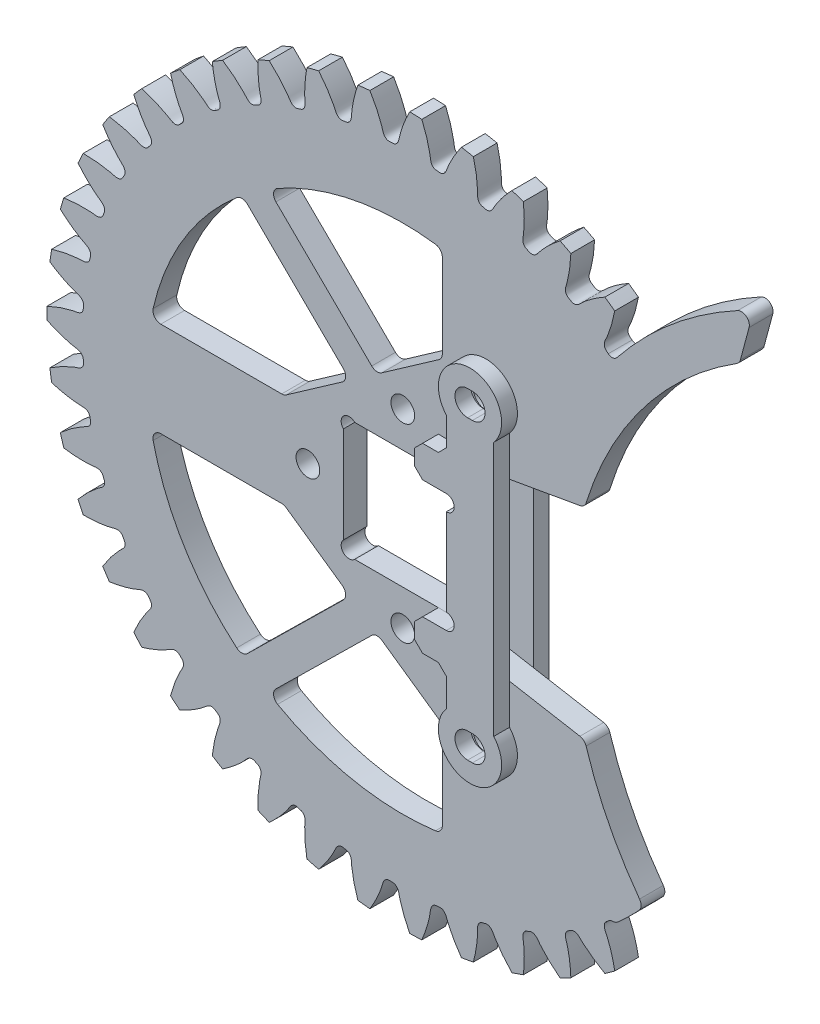
from build123d import *

# Parameters (mm, degrees)
SKETCH_432_W               = 3
SKETCH_432_H               = 44.999999324
CUT_EXTRUDE_650_DEPTH      = 2
PATTERN_CIRCULAR_704_COUNT = 43
SKETCH_763_W               = 4
SKETCH_763_H               = 5
SKETCH_1_R                 = 1
SKETCH_1_W                 = 15
SKETCH_1_H                 = 15
CUT_EXTRUDE_1_DEPTH        = 64.704229892
SKETCH_2_R                 = 1.5
CUT_EXTRUDE_2_DEPTH        = 64.704229892
SKETCH_3_R                 = 50
CUT_EXTRUDE_3_DEPTH        = 64.704229892
EXTRUDE_1_DEPTH            = 3
FILLET_1_R                 = 1
FILLET_START               = -1.5
FILLET_4_DEPTH             = 3
CUT_EXTRUDE_4_DEPTH        = 64.704229892
FILLET_2_R                 = 1
SKETCH_6_R                 = 1.6
CUT_EXTRUDE_5_DEPTH        = 64.704229892
FILLET_3_R                 = 1
CHAMFER_1_SIZE             = 1
EXTRUDE_2_DEPTH            = 2
CHAMFER_2_SIZE             = 1


with BuildPart() as part:
    # Sketch 432 → Revolve 518 (revolve)
    with BuildSketch(Plane(origin=(0, 0, 0), x_dir=(0, 0, -1), z_dir=(1, 0, 0)), mode=Mode.PRIVATE) as revolve_518_sk:
        with Locations((0, 22.499999662)):
            Rectangle(SKETCH_432_W, SKETCH_432_H)
    revolve(revolve_518_sk.sketch.rotate(Axis((0, 0, 0), (0, 0, -1)), 90), axis=Axis((0, 0, 0), (0, 0, -1)))

    # Sketch 563 → Cut-Extrude 650 (cut, symmetric)
    with BuildSketch(Plane.XY):
        with BuildLine():
            ThreePointArc((45.026398895, 2.575527419), (45.099999323, 0), (45.026398895, -2.575527419))
            add(Edge.make_bspline(
                [(45.026398895, -2.575527419), (44.844188684, -2.471831889), (44.573098192, -2.323126156), (44.213188297, -2.137137984), (43.955328836, -2.009143088), (43.705036, -1.889925261), (43.462524224, -1.779204049), (43.22800081, -1.676694331), (43.001665855, -1.582106479), (42.783712071, -1.495146845), (42.574325032, -1.415516704), (42.373681913, -1.342916656), (42.181955522, -1.277032112), (41.999300003, -1.217584151), (41.825899693, -1.164155313), (41.661801518, -1.116786833), (41.449245229, -1.057776274), (41.272330602, -1.0199091), (41.13477341, -0.976751946), (41.086864702, -0.959978472), (41.039501997, -0.941549969), (40.992461851, -0.921150658), (40.945483978, -0.898384694), (40.898291673, -0.87271315), (40.85061019, -0.843417432), (40.802213114, -0.809544406), (40.753008656, -0.769853702), (40.703191342, -0.72278705), (40.653479283, -0.666512214), (40.605437205, -0.599136088), (40.561758724, -0.51919623), (40.526387861, -0.426507691), (40.504517881, -0.327286819), (40.495755817, -0.183671941), (40.502966477, 0), (40.495755817, 0.183671941), (40.504517881, 0.327286819), (40.526387861, 0.426507691), (40.561758724, 0.51919623), (40.605437205, 0.599136088), (40.653479283, 0.666512214), (40.703191342, 0.72278705), (40.753008656, 0.769853702), (40.802213114, 0.809544406), (40.85061019, 0.843417432), (40.898291673, 0.87271315), (40.945483978, 0.898384694), (40.992461851, 0.921150658), (41.039501997, 0.941549969), (41.086864702, 0.959978472), (41.13477341, 0.976751946), (41.272330602, 1.0199091), (41.449245229, 1.057776274), (41.661801518, 1.116786833), (41.825899693, 1.164155313), (41.999300003, 1.217584151), (42.181955522, 1.277032112), (42.373681913, 1.342916656), (42.574325032, 1.415516704), (42.783712071, 1.495146845), (43.001665855, 1.582106479), (43.22800081, 1.676694331), (43.462524224, 1.779204049), (43.705036, 1.889925261), (43.955328836, 2.009143088), (44.213188297, 2.137137984), (44.573098192, 2.323126156), (44.844188684, 2.471831889), (45.026398895, 2.575527419)],
                knots=[0, 0, 0, 0, 0.05715422, 0.084280582, 0.110439779, 0.135631811, 0.159856677, 0.183114377, 0.205404913, 0.226728283, 0.247084487, 0.266473527, 0.284895401, 0.302350109, 0.318837653, 0.334358031, 0.348911243, 0.378974861, 0.383602617, 0.388205042, 0.392810689, 0.397454478, 0.402179258, 0.407037685, 0.412094315, 0.417427641, 0.423131358, 0.429313368, 0.43608978, 0.4435697, 0.45182642, 0.460855119, 0.470529938, 0.479394686, 0.5, 0.520605314, 0.529470062, 0.539144881, 0.54817358, 0.5564303, 0.56391022, 0.570686632, 0.576868642, 0.582572359, 0.587905685, 0.592962315, 0.597820742, 0.602545522, 0.607189311, 0.611794958, 0.616397383, 0.621025139, 0.651088757, 0.665641969, 0.681162347, 0.697649891, 0.715104599, 0.733526473, 0.752915513, 0.773271717, 0.794595087, 0.816885623, 0.840143323, 0.864368189, 0.889560221, 0.915719418, 0.94284578, 1, 1, 1, 1], degree=3))
        make_face()
    cut_extrude_650 = extrude(amount=CUT_EXTRUDE_650_DEPTH, both=True, mode=Mode.SUBTRACT)

    # Pattern Circular 704: Cut-Extrude 650 ×43 about axis
    pattern_circular_704_axis = Axis((0, 0, 55), (0, 0, -1))
    for i in range(1, PATTERN_CIRCULAR_704_COUNT):
        add(cut_extrude_650.rotate(pattern_circular_704_axis, i * 360 / PATTERN_CIRCULAR_704_COUNT), mode=Mode.SUBTRACT)

    # Sketch 763 → Cut-Revolve 838 (revolve, cut)
    with BuildSketch(Plane(origin=(0, 0, 0), x_dir=(0, 0, -1), z_dir=(1, 0, 0)), mode=Mode.PRIVATE) as cut_revolve_838_sk:
        with Locations((0, 2.5)):
            Rectangle(SKETCH_763_W, SKETCH_763_H)
    revolve(cut_revolve_838_sk.sketch.rotate(Axis((0, 0, 0), (0, 0, -1)), 90), axis=Axis((0, 0, 0), (0, 0, -1)), mode=Mode.SUBTRACT)

    # 草图1 → 切除-拉伸1 (cut, through all)
    with BuildSketch(Plane.XY.offset(1.5)):
        with Locations((-6.792893219, -6.792893219)):
            Circle(SKETCH_1_R)
        with Locations((-6.792893219, 6.792893219)):
            Circle(SKETCH_1_R)
        Rectangle(SKETCH_1_W, SKETCH_1_H)
    extrude(amount=-CUT_EXTRUDE_1_DEPTH, mode=Mode.SUBTRACT)

    # 草图2 → 切除-拉伸2 (cut, through all)
    with BuildSketch(Plane.XY.offset(1.5)):
        with Locations((0, -12)):
            Circle(SKETCH_2_R)
        with Locations((-12, 0)):
            Circle(SKETCH_2_R)
        with Locations((0, 12)):
            Circle(SKETCH_2_R)
        with Locations((12, 0)):
            Circle(SKETCH_2_R)
    extrude(amount=-CUT_EXTRUDE_2_DEPTH, mode=Mode.SUBTRACT)

    # 草图3 → 切除-拉伸3 (cut, through all)
    with BuildSketch(Plane.XY.offset(1.5)):
        with Locations((66.168546922, 0)):
            Circle(SKETCH_3_R)
    extrude(amount=-CUT_EXTRUDE_3_DEPTH, mode=Mode.SUBTRACT)

    # 草图4 → 凸台-拉伸1 (add)
    with BuildSketch(Plane.XY.offset(1.5)):
        with BuildLine():
            Line((44.374052204, 45), (42.585633099, 38.325529032))
            ThreePointArc((42.585633099, 38.325529032), (21.919199062, 8.185060415), (30.436561331, -27.353705521))
            ThreePointArc((30.436561331, -27.353705521), (28.696248589, -29.174214442), (26.847242674, -30.884219793))
            ThreePointArc((26.847242674, -30.884219793), (17.451107291, 11.252158717), (44.374052204, 45))
        make_face()
    extrude(amount=-EXTRUDE_1_DEPTH)

    # 圆角1
    fillet_1_edges = [part.edges().sort_by_distance(p)[0] for p in [
        (44.374052204, 45, 0),
        (42.585633099, 38.325529032, 0),
        (30.436561331, -27.353705521, 0),
        (26.847242674, -30.884219793, -0.75),
    ]]
    fillet(fillet_1_edges, radius=FILLET_1_R)

    # 圆角4: read off the stored shape, not the designer's step
    # 圆角4 outline → 圆角4 (add)
    with BuildSketch(Plane.XY.offset(FILLET_START)):
        with BuildLine():
            ThreePointArc((26.847242674, 30.884219793), (26.956282021, 31.022544727), (27.065807967, 31.160484692))
            ThreePointArc((27.065807967, 31.160484692), (26.551111631, 30.881341005), (25.992627228, 31.057206544))
            add(Edge.make_bspline(
                [(25.992627228, 31.057206544), (26.021554246, 31.032539655), (26.075570375, 30.987182835), (26.161215416, 30.924325269), (26.251470893, 30.877666651), (26.34534146, 30.845564006), (26.434726949, 30.828001976), (26.517246637, 30.821830691), (26.592301592, 30.824044229), (26.660346031, 30.832228897), (26.722328941, 30.84466069), (26.779323649, 30.860193304), (26.82030538, 30.874037599), (26.842461203, 30.882379729), (26.847242674, 30.884219793)],
                knots=[0.510241969, 0.510241969, 0.510241969, 0.510241969, 0.520605314, 0.529470062, 0.539144881, 0.54817358, 0.5564303, 0.56391022, 0.570686632, 0.576868642, 0.582572359, 0.587905685, 0.592962315, 0.594358879, 0.594358879, 0.594358879, 0.594358879], degree=3))
        make_face()
    extrude(amount=FILLET_4_DEPTH)

    # 草图5 → 切除-拉伸4 (cut, through all)
    with BuildSketch(Plane.XY.offset(1.5)):
        with BuildLine():
            Line((-3.333771145, 14.166360199), (5, 20))
            Line((5, 20), (5, 32))
            ThreePointArc((5, 32), (-6.380351533, 31.753600021), (-16.972598189, 27.584976177))
            Line((-16.972598189, 27.584976177), (-3.333771145, 14.166360199))
        make_face()
        with BuildLine():
            Line((-15, 6), (-6.666228855, 11.833639801))
            Line((-6.666228855, 11.833639801), (-20.294292291, 25.24166596))
            ThreePointArc((-20.294292291, 25.24166596), (-27.780117512, 16.651278359), (-31.827660926, 6))
            Line((-31.827660926, 6), (-15, 6))
        make_face()
        with BuildLine():
            Line((-6.666228855, -11.833639801), (-15, -6))
            Line((-15, -6), (-31.827660926, -6))
            ThreePointArc((-31.827660926, -6), (-27.780117512, -16.651278359), (-20.294292291, -25.24166596))
            Line((-20.294292291, -25.24166596), (-6.666228855, -11.833639801))
        make_face()
        with BuildLine():
            Line((5, -20), (-3.333771145, -14.166360199))
            Line((-3.333771145, -14.166360199), (-16.972598189, -27.584976177))
            ThreePointArc((-16.972598189, -27.584976177), (-6.380351533, -31.753600021), (5, -32))
            Line((5, -32), (5, -20))
        make_face()
    extrude(amount=-CUT_EXTRUDE_4_DEPTH, mode=Mode.SUBTRACT)

    # 圆角2
    fillet_2_edges = [part.edges().sort_by_distance(p)[0] for p in [
        (-31.827660926, 6, 0),
        (-20.294292291, 25.24166596, 0),
        (-6.666228855, 11.833639801, 0),
        (-15, 6, 0),
        (-31.827660926, -6, 0),
        (-15, -6, 0),
        (-6.666228855, -11.833639801, 0),
        (-20.294292291, -25.24166596, 0),
        (-16.972598189, -27.584976177, 0),
        (-3.333771145, -14.166360199, 0),
        (5, -20, 0),
        (5, -32, 0),
        (-16.972598189, 27.584976177, 0),
        (5, 32, 0),
        (5, 20, 0),
        (-3.333771145, 14.166360199, 0),
    ]]
    fillet(fillet_2_edges, radius=FILLET_2_R)

    # 草图6 → 切除-拉伸5 (cut, through all)
    with BuildSketch(Plane.XY.offset(1.5)):
        with Locations((10.5, 18.75)):
            Circle(SKETCH_6_R)
        with Locations(Location((10.5, -18.75, 0), (0, 0, 180))):
            Circle(SKETCH_6_R)
        with BuildLine():
            Line((7.5, -10), (7.5, 10))
            Line((7.5, 10), (23.007997084, 12.734478303))
            ThreePointArc((23.007997084, 12.734478303), (21.168546922, 0), (23.007997084, -12.734478303))
            Line((23.007997084, -12.734478303), (7.5, -10))
        make_face()
    extrude(amount=-CUT_EXTRUDE_5_DEPTH, mode=Mode.SUBTRACT)

    # 圆角3
    fillet_3_edges = [part.edges().sort_by_distance(p)[0] for p in [
        (23.007997084, 12.734478303, 0),
        (23.007997084, -12.734478303, 0),
        (7.5, -10, 0),
        (7.5, 10, 0),
    ]]
    fillet(fillet_3_edges, radius=FILLET_3_R)

    # 倒角1
    chamfer_1_edges = [part.edges().sort_by_distance(p)[0] for p in [
        (7.5, 7.5, 0),
        (7.5, -7.5, 0),
    ]]
    chamfer(chamfer_1_edges, length=CHAMFER_1_SIZE)


with BuildPart() as body_2:
    # 草图8 → 凸台-拉伸2 (new body)
    with BuildSketch(Plane.XY.offset(1.5)):
        with BuildLine():
            Line((7.5, -16.104248689), (7.5, -11.5))
            Line((7.5, -11.5), (3.5, -11.5))
            Line((3.5, -11.5), (3.5, -7.5))
            Line((3.5, -7.5), (7.5, -7.5))
            ThreePointArc((7.5, -7.5), (8.5, -6.5), (7.5, -5.5))
            Line((7.5, -5.5), (7.5, 5.5))
            ThreePointArc((7.5, 5.5), (8.5, 6.5), (7.5, 7.5))
            Line((7.5, 7.5), (3.5, 7.5))
            Line((3.5, 7.5), (3.5, 11.5))
            Line((3.5, 11.5), (7.5, 11.5))
            Line((7.5, 11.5), (7.5, 16.104248689))
            ThreePointArc((7.5, 16.104248689), (10.5, 22.75), (13.5, 16.104248689))
            Line((13.5, 16.104248689), (13.5, -16.104248689))
            ThreePointArc((13.5, -16.104248689), (10.5, -22.75), (7.5, -16.104248689))
        make_face()
        with BuildLine():
            Line((10.2, -17.15), (10.8, -17.15))
            ThreePointArc((10.8, -17.15), (12.4, -18.75), (10.8, -20.35))
            Line((10.8, -20.35), (10.2, -20.35))
            ThreePointArc((10.2, -20.35), (8.6, -18.75), (10.2, -17.15))
        make_face(mode=Mode.SUBTRACT)
        with BuildLine():
            Line((10.2, 17.15), (10.8, 17.15))
            ThreePointArc((10.8, 17.15), (12.4, 18.75), (10.8, 20.35))
            Line((10.8, 20.35), (10.2, 20.35))
            ThreePointArc((10.2, 20.35), (8.6, 18.75), (10.2, 17.15))
        make_face(mode=Mode.SUBTRACT)
    extrude(amount=EXTRUDE_2_DEPTH)

    # 倒角2
    chamfer_2_edges = [body_2.edges().sort_by_distance(p)[0] for p in [
        (3.5, 7.5, 2.5),
        (3.5, 11.5, 2.5),
        (7.5, 11.5, 2.5),
        (7.5, -11.5, 2.5),
        (3.5, -11.5, 2.5),
        (3.5, -7.5, 2.5),
    ]]
    chamfer(chamfer_2_edges, length=CHAMFER_2_SIZE)


with BuildPart() as body_3:
    # 镜向1: mirrored copy
    add(body_2.part.mirror(Plane.XY))


solid = Compound([part.part, body_2.part, body_3.part])
